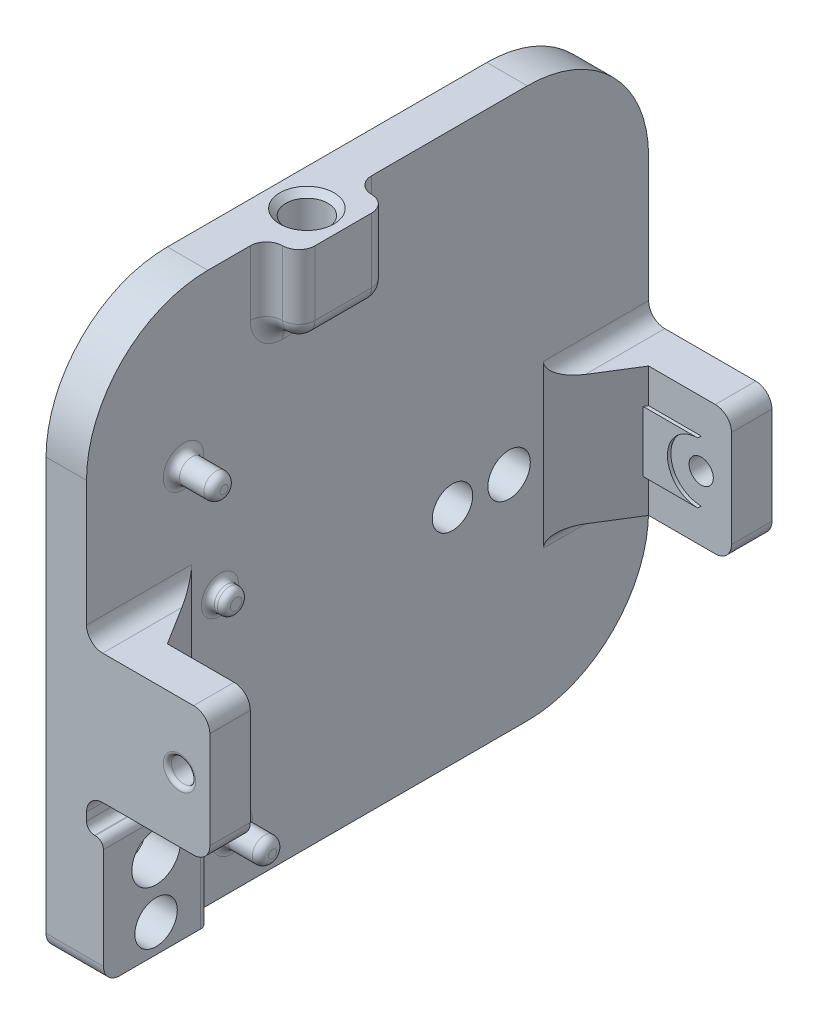
from build123d import *

# Parameters (mm, degrees)
SKETCH1_W           = 55
SKETCH1_H           = 69.5
SKETCH1_R           = 3
SKETCH1_R_2         = 2.5
SKETCH1_R_3         = 2.625
BOSS_EXTRUDE1_DEPTH = 5
SKETCH3_W           = 16
SKETCH3_H           = 5
BOSS_EXTRUDE2_DEPTH = 15.25
SKETCH4_R           = 1.5
CUT_EXTRUDE1_DEPTH  = 88.151090068
SKETCH5_W           = 10.4
SKETCH5_H           = 1.2
CUT_EXTRUDE2_DEPTH  = 2
SKETCH6_W           = 15.5
SKETCH6_H           = 13
SKETCH6_R           = 3
SKETCH6_R_2         = 2.625
BOSS_EXTRUDE3_DEPTH = 2.1
SKETCH13_R          = 1.5
BOSS_EXTRUDE5_DEPTH = 5
SKETCH14_R          = 1.5
BOSS_EXTRUDE6_DEPTH = 2
CUT_EXTRUDE3_START  = -1
CUT_EXTRUDE3_DEPTH  = 1
CHAMFER1_SIZE       = 8
CHAMFER1_SIZE2      = 5
CHAMFER2_SIZE       = 5
CHAMFER2_SIZE2      = 8
FILLET3_R           = 0.5
FILLET2_R           = 2
FILLET4_R           = 1
FILLET5_R           = 0.8
BOSS_EXTRUDE4_DEPTH = 0.42
SKETCH18_W          = 5
SKETCH18_H          = 69.5
BOSS_EXTRUDE8_DEPTH = 13
SKETCH15_W          = 10
SKETCH15_H          = 11
BOSS_EXTRUDE7_DEPTH = 4
FILLET1_R           = 15
SKETCH16_R          = 2.6
CUT_EXTRUDE8_DEPTH  = 9
CHAMFER3_SIZE       = 0.75
FILLET6_R           = 2


# Read off the part's stored shape, not the designer's step: Cut-Extrude3
with BuildPart() as part:
    # Sketch1 → Boss-Extrude1 (new body)
    with BuildSketch(Plane.YZ):
        with Locations((27.5, 34.75)):
            Rectangle(SKETCH1_W, SKETCH1_H)
        with Locations(Location((10.5, 63, 0), (0, 0, 270))):
            Circle(SKETCH1_R, mode=Mode.SUBTRACT)
        with Locations(Location((27.5, 24.25, 0), (0, 0, 270))):
            Circle(SKETCH1_R_2, mode=Mode.SUBTRACT)
        with Locations(Location((3.5, 63, 0), (0, 0, 270))):
            Circle(SKETCH1_R_3, mode=Mode.SUBTRACT)
        with Locations(Location((27.5, 17.25, 0), (0, 0, 270))):
            Circle(SKETCH1_R_3, mode=Mode.SUBTRACT)
    extrude(amount=BOSS_EXTRUDE1_DEPTH)

    # Sketch3 → Boss-Extrude2 (add)
    with BuildSketch(Plane.YZ.offset(5)):
        with Locations((27.5, 67)):
            Rectangle(SKETCH3_W, SKETCH3_H)
    boss_extrude2 = extrude(amount=BOSS_EXTRUDE2_DEPTH)

    # Sketch4 → Cut-Extrude1 (cut, through all)
    with BuildSketch(Plane(origin=(0, 0, 64.5), x_dir=(1, 0, 0), z_dir=(0, 0, -1))):
        with Locations(Location((16.5, -27.5, 0), (0, 0, 180))):
            Circle(SKETCH4_R)
    cut_extrude1 = extrude(amount=-CUT_EXTRUDE1_DEPTH, mode=Mode.SUBTRACT)

    # Mirror1: Boss-Extrude2, Cut-Extrude1 across plane
    add(boss_extrude2.mirror(Plane(origin=(0, 0, 34.75), x_dir=(1, 0, 0), z_dir=(0, 0, -1))))
    add(cut_extrude1.mirror(Plane(origin=(0, 0, 34.75), x_dir=(1, 0, 0), z_dir=(0, 0, -1))), mode=Mode.SUBTRACT)

    # Sketch5 → Cut-Extrude2 (cut)
    with BuildSketch(Plane(origin=(0, 0, 0), x_dir=(0, -1, 0), z_dir=(-1, 0, 0))):
        Polygon((-6.398780669, 59.747308807), (-7.247308807, 58.898780669), (-14.601219331, 66.252691193), (-13.752691193, 67.101219331), align=None)
        with Locations((-27.5, 24.25)):
            Rectangle(SKETCH5_W, SKETCH5_H)
    extrude(amount=-CUT_EXTRUDE2_DEPTH, mode=Mode.SUBTRACT)

    # Sketch6 → Boss-Extrude3 (add)
    with BuildSketch(Plane.YZ.offset(5)):
        with Locations((7.75, 63)):
            Rectangle(SKETCH6_W, SKETCH6_H)
        with Locations(Location((10.5, 63, 0), (0, 0, 56.536959033))):
            Circle(SKETCH6_R, mode=Mode.SUBTRACT)
        with Locations(Location((3.5, 63, 0), (0, 0, 270))):
            Circle(SKETCH6_R_2, mode=Mode.SUBTRACT)
    extrude(amount=BOSS_EXTRUDE3_DEPTH)

    # Sketch13 → Boss-Extrude5 (add)
    with BuildSketch(Plane.YZ.offset(5)):
        with Locations(Location((48.5, 57.5, 0), (0, 0, 90))):
            Circle(SKETCH13_R)
        with Locations(Location((6.5, 51.5, 0), (0, 0, 90))):
            Circle(SKETCH13_R)
    extrude(amount=BOSS_EXTRUDE5_DEPTH)

    # Sketch14 → Boss-Extrude6 (add)
    with BuildSketch(Plane.YZ.offset(5)):
        with Locations(Location((32.5, 53, 0), (0, 0, 90))):
            Circle(SKETCH14_R)
    extrude(amount=BOSS_EXTRUDE6_DEPTH)

    # Cut-Extrude3 outline → Cut-Extrude3 (cut)
    with BuildSketch(Plane(origin=(2, 0, 0), x_dir=(0, -1, 0), z_dir=(-1, 0, 0)).offset(CUT_EXTRUDE3_START)):
        with BuildLine():
            Line((-7.247308807, 58.898780669), (-6.398780669, 59.747308807))
            Line((-6.398780669, 59.747308807), (-7.997274962, 61.3458031))
            ThreePointArc((-7.997274962, 61.3458031), (-8.378679656, 60.878679656), (-8.8458031, 60.497274962))
            Line((-8.8458031, 60.497274962), (-7.247308807, 58.898780669))
        make_face()
        with BuildLine():
            Line((-14.601219331, 66.252691193), (-13.002725038, 64.6541969))
            ThreePointArc((-13.002725038, 64.6541969), (-12.621320344, 65.121320344), (-12.1541969, 65.502725038))
            Line((-12.1541969, 65.502725038), (-13.752691193, 67.101219331))
            Line((-13.752691193, 67.101219331), (-14.601219331, 66.252691193))
        make_face()
    extrude(amount=CUT_EXTRUDE3_DEPTH, mode=Mode.SUBTRACT)

    # Chamfer1
    chamfer1_edges = [part.edges().sort_by_distance(p)[0] for p in [
        (5, 27.5, 64.5),
    ]]
    chamfer1_side = [part.faces().sort_by_distance(p)[0] for p in [
        (5, 28.660590977, 33.127058203),
    ]]
    chamfer(chamfer1_edges, length=CHAMFER1_SIZE, length2=CHAMFER1_SIZE2, reference=chamfer1_side[0])

    # Chamfer2
    chamfer2_edges = [part.edges().sort_by_distance(p)[0] for p in [
        (5, 27.5, 5),
    ]]
    chamfer2_side = [part.faces().sort_by_distance(p)[0] for p in [
        (12.509393715, 27.5, 5),
    ]]
    chamfer(chamfer2_edges, length=CHAMFER2_SIZE, length2=CHAMFER2_SIZE2, reference=chamfer2_side[0])

    # Fillet3
    fillet3_edges = [part.edges().sort_by_distance(p)[0] for p in [
        (18, 27.5, 69.5),
        (18, 27.5, 0),
    ]]
    fillet(fillet3_edges, radius=FILLET3_R)

    # Fillet2
    fillet2_edges = [part.edges().sort_by_distance(p)[0] for p in [
        (5, 19.5, 63),
        (5, 35.5, 63),
        (20.25, 19.5, 67),
        (20.25, 35.5, 67),
        (20.25, 19.5, 2.5),
        (20.25, 35.5, 2.5),
        (5, 19.5, 6.5),
        (5, 35.5, 6.5),
        (3.55, 0, 69.5),
    ]]
    fillet(fillet2_edges, radius=FILLET2_R)

    # Fillet4
    fillet4_edges = [part.edges().sort_by_distance(p)[0] for p in [
        (7.1, 7.75, 56.5),
        (7.1, 15.5, 63),
        (5, 7.75, 56.5),
        (5, 15.5, 63),
        (6.05, 15.5, 56.5),
        (5, 6.5, 50),
        (5, 48.5, 56),
        (10, 48.5, 56),
        (10, 6.5, 50),
    ]]
    fillet(fillet4_edges, radius=FILLET4_R)

    # Fillet5
    fillet5_edges = [part.edges().sort_by_distance(p)[0] for p in [
        (5, 32.5, 51.5),
        (7, 32.5, 51.5),
    ]]
    fillet(fillet5_edges, radius=FILLET5_R)

    # Sketch8 → Boss-Extrude4 (add)
    with BuildSketch(Plane(origin=(0, 0, 64.5), x_dir=(1, 0, 0), z_dir=(0, 0, -1))):
        with BuildLine():
            Line((9.5, -23.75), (16.5, -23.75))
            ThreePointArc((16.5, -23.75), (12.75, -27.5), (16.5, -31.25))
            Line((16.5, -31.25), (9.5, -31.25))
            Line((9.5, -31.25), (9.5, -23.75))
        make_face()
    boss_extrude4 = extrude(amount=BOSS_EXTRUDE4_DEPTH)

    # Mirror2: Boss-Extrude4 across plane
    add(boss_extrude4.mirror(Plane(origin=(0, 0, 34.75), x_dir=(1, 0, 0), z_dir=(0, 0, -1))))

    # Sketch18 → Boss-Extrude8 (add)
    with BuildSketch(Plane(origin=(0, 55, 0), x_dir=(-1, 0, 0), z_dir=(0, 1, 0))):
        with Locations((-2.5, 34.75)):
            Rectangle(SKETCH18_W, SKETCH18_H)
    extrude(amount=BOSS_EXTRUDE8_DEPTH)

    # Sketch15 → Boss-Extrude7 (add)
    with BuildSketch(Plane.YZ.offset(5)):
        with Locations((63, 41.75)):
            Rectangle(SKETCH15_W, SKETCH15_H)
    extrude(amount=BOSS_EXTRUDE7_DEPTH)

    # Fillet1
    fillet1_edges = [part.edges().sort_by_distance(p)[0] for p in [
        (2.5, 68, 0),
        (2.5, 68, 69.5),
        (2.5, 0, 0),
    ]]
    fillet(fillet1_edges, radius=FILLET1_R)

    # Sketch16 → Cut-Extrude8 (cut)
    with BuildSketch(Plane(origin=(0, 68, 0), x_dir=(-1, 0, 0), z_dir=(0, 1, 0))):
        with Locations(Location((-4.5, 41.75, 0), (0, 0, 90))):
            Circle(SKETCH16_R)
    extrude(amount=-CUT_EXTRUDE8_DEPTH, mode=Mode.SUBTRACT)

    # Chamfer3
    chamfer3_edges = [part.edges().sort_by_distance(p)[0] for p in [
        (4.5, 68, 39.15),
    ]]
    chamfer(chamfer3_edges, length=CHAMFER3_SIZE)

    # Fillet6
    fillet6_edges = [part.edges().sort_by_distance(p)[0] for p in [
        (5, 63, 47.25),
        (5, 58, 41.75),
        (7, 58, 47.25),
        (5, 63, 36.25),
        (7, 58, 36.25),
        (9, 63, 47.25),
        (9, 58, 41.75),
        (9, 63, 36.25),
    ]]
    fillet(fillet6_edges, radius=FILLET6_R - 0.0001)  # a hair under: the kernel refuses the full size


solid = part.part
